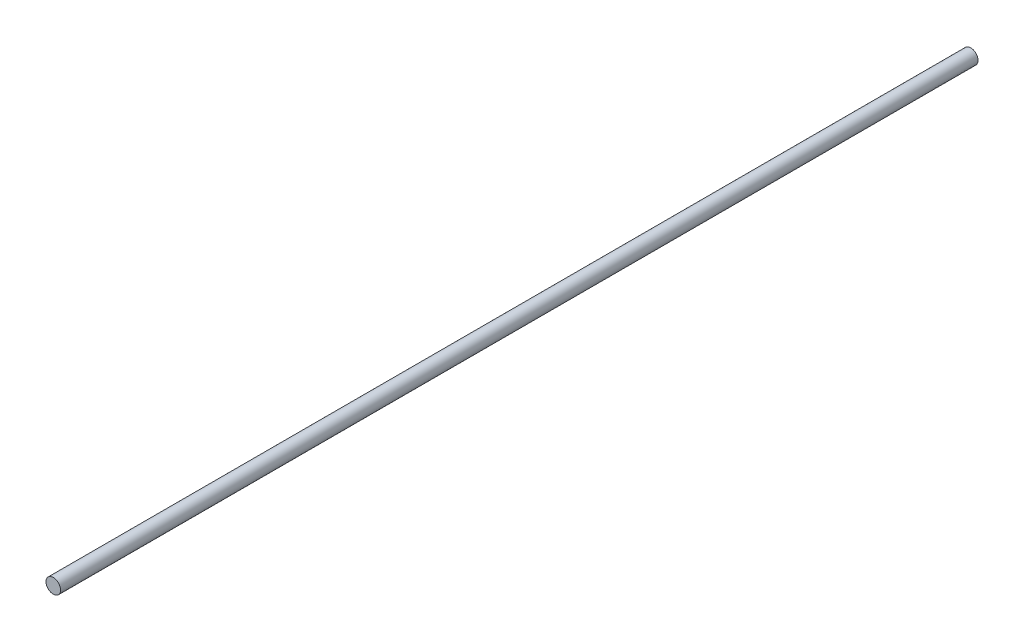
from build123d import *

# Parameters (mm, degrees)
SKETCH1_R           = 3.175
BOSS_EXTRUDE1_DEPTH = 200.025


with BuildPart() as part:
    # Sketch1 → Boss-Extrude1 (new, symmetric)
    with BuildSketch(Plane.XY):
        Circle(SKETCH1_R)
    extrude(amount=BOSS_EXTRUDE1_DEPTH, both=True)


solid = part.part
